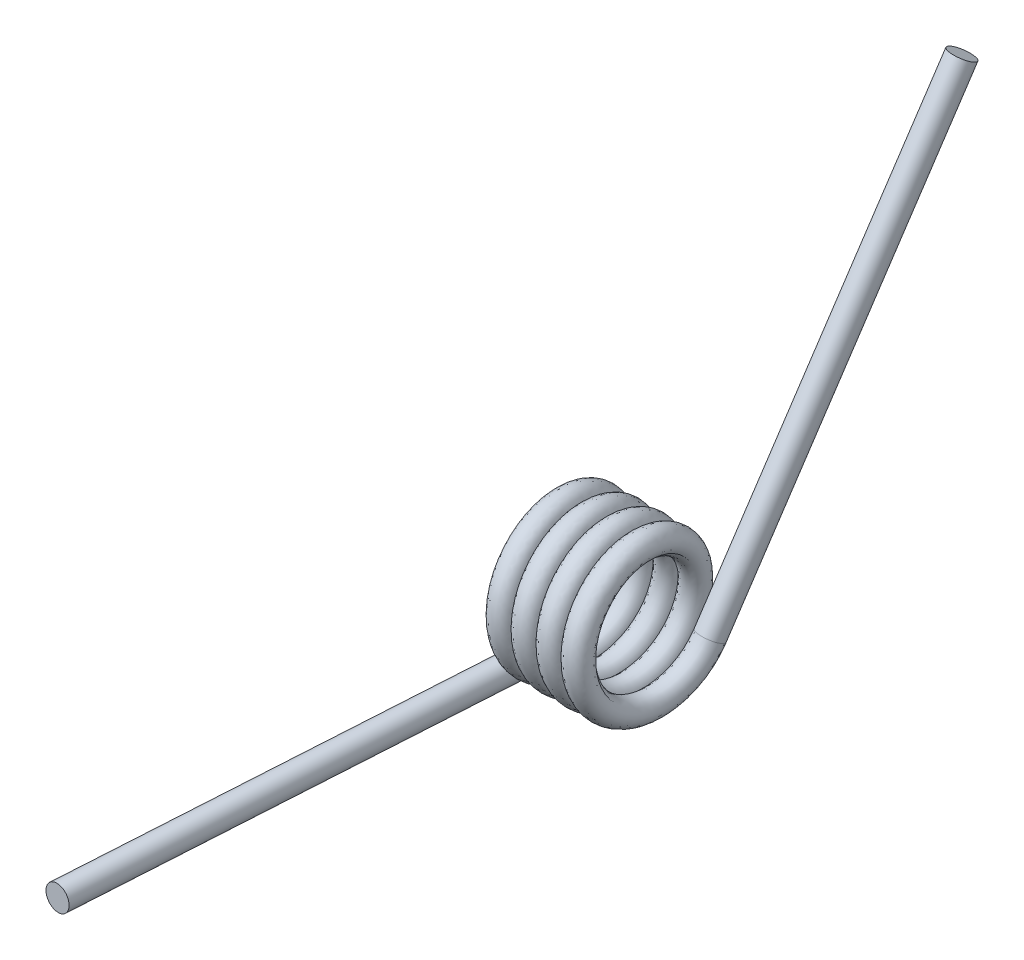
from build123d import *

# Parameters (mm, degrees)
SWEEP1_PITCH   = 2.1844
SKETCH3_R      = 1.0795
EXTRUDE1_DEPTH = 40.64
SKETCH4_R      = 1.0795
EXTRUDE2_DEPTH = 40.64


with BuildPart() as part:
    # Sweep1: the profile of Sketch2 screwed along a right-hand helix of 4.17 turns, 6 arcs to a turn; built about Z, then put on its axis
    sweep1_z = Axis((0, 0, 0), (0, 0, 1))
    sweep1_corners = [(5.55553317, -0.066018869, 1.073197152), (6.726725845, -0.005892364, 0.095785764), (5.74746683, 0.066018869, -1.073197152), (4.576274155, 0.005892364, -0.095785764)]
    with BuildLine(mode=Mode.PRIVATE) as sweep1_profile:
        ThreePointArc((5.55553317, -0.066018869, 1.073197152), (6.34394069, -0.05084892, 0.826595747), (6.726725845, -0.005892364, 0.095785764))
        ThreePointArc((6.726725845, -0.005892364, 0.095785764), (6.479658283, 0.04251586, -0.69113422), (5.74746683, 0.066018869, -1.073197152))
        ThreePointArc((5.74746683, 0.066018869, -1.073197152), (4.95905931, 0.05084892, -0.826595747), (4.576274155, 0.005892364, -0.095785764))
        ThreePointArc((4.576274155, 0.005892364, -0.095785764), (4.823341717, -0.04251586, 0.69113422), (5.55553317, -0.066018869, 1.073197152))
    sweep1_cap = Face(sweep1_profile.wire())
    sweep1_arcs = [((5.55553317, -0.066018869, 1.073197152), (6.630759014, -0.071911232, 1.168982916), (6.726725845, -0.005892364, 0.095785764), (1, 0.7071067811865476, 1)), ((6.726725845, -0.005892364, 0.095785764), (6.822692675, 0.060126505, -0.977411388), (5.74746683, 0.066018869, -1.073197152), (1, 0.7071067811865476, 1)), ((5.74746683, 0.066018869, -1.073197152), (4.672240986, 0.071911232, -1.168982916), (4.576274155, 0.005892364, -0.095785764), (1, 0.7071067811865476, 1)), ((4.576274155, 0.005892364, -0.095785764), (4.480307325, -0.060126505, 0.977411388), (5.55553317, -0.066018869, 1.073197152), (1, 0.7071067811865476, 1))]  # start, shoulder, end, weights
    sweep1_turn_angles = [0, 30, 60, 90, 120, 150, 180, 210, 240, 270, 300, 330, 360]
    sweep1_turn_weights = [1, 0.8660254037844387, 1, 0.8660254037844387, 1, 0.8660254037844387, 1, 0.8660254037844387, 1, 0.8660254037844387, 1, 0.8660254037844387, 1]
    sweep1_turn_sides = [Face.make_bezier_surface([[Vector(p[j][0], p[j][1], 0).rotate(sweep1_z, sweep1_turn_angles[2 * i + k]) / sweep1_turn_weights[2 * i + k] + Vector(0, 0, p[j][2] + SWEEP1_PITCH * sweep1_turn_angles[2 * i + k] / 360) for k in range(3)] for j in range(3)], [[p[3][j] * sweep1_turn_weights[2 * i + k] for k in range(3)] for j in range(3)]) for p in sweep1_arcs for i in range(6)]
    sweep1_last_angles = [1440, 1470, 1500, 1500.6, 1501.2]
    sweep1_last_weights = [1, 0.8660254037844387, 1, 0.9999451693655119, 1]
    sweep1_last_sides = [Face.make_bezier_surface([[Vector(p[j][0], p[j][1], 0).rotate(sweep1_z, sweep1_last_angles[2 * i + k]) / sweep1_last_weights[2 * i + k] + Vector(0, 0, p[j][2] + SWEEP1_PITCH * sweep1_last_angles[2 * i + k] / 360) for k in range(3)] for j in range(3)], [[p[3][j] * sweep1_last_weights[2 * i + k] for k in range(3)] for j in range(3)]) for p in sweep1_arcs for i in range(2)]
    sweep1 = Plane(origin=(0, 0, 0), x_dir=(0, -1, 0), z_dir=(1, 0, 0)) * Solid(Shell([*[p.moved(Location((0, 0, SWEEP1_PITCH * i))) for i in range(4) for p in sweep1_turn_sides], *sweep1_last_sides, sweep1_cap, sweep1_cap.rotate(sweep1_z, 1501.2).moved(Location((0, 0, SWEEP1_PITCH * 1501.2 / 360)))]))
    add(sweep1)

    # Sketch3 → Extrude1 (add)
    with BuildSketch(Plane(origin=(0, 0, 0), x_dir=(-0.9941613262645035, -0.08889933338030652, -0.06115689564178949), z_dir=(-0.06140000183272062, -1.1654739673350178e-14, 0.9981132399557388))):
        with Locations(Location((0.502414583, 5.629123541, 0), (0, 0, 174.899710282))):
            Circle(SKETCH3_R)
    extrude(amount=EXTRUDE1_DEPTH)

    # Sketch4 → Extrude2 (add)
    with BuildSketch(Plane(origin=(0.034340372, 0.48918434, -0.268931367), x_dir=(0.9917527835165177, -0.10776254017565946, -0.06938048228521158), z_dir=(0.0614000018327206, 0.8746532996134688, -0.4808447205181871))):
        with Locations(Location((9.67082533, 4.590720934, 0), (0, 0, 173.528234673))):
            Circle(SKETCH4_R)
    extrude(amount=EXTRUDE2_DEPTH)


solid = part.part
